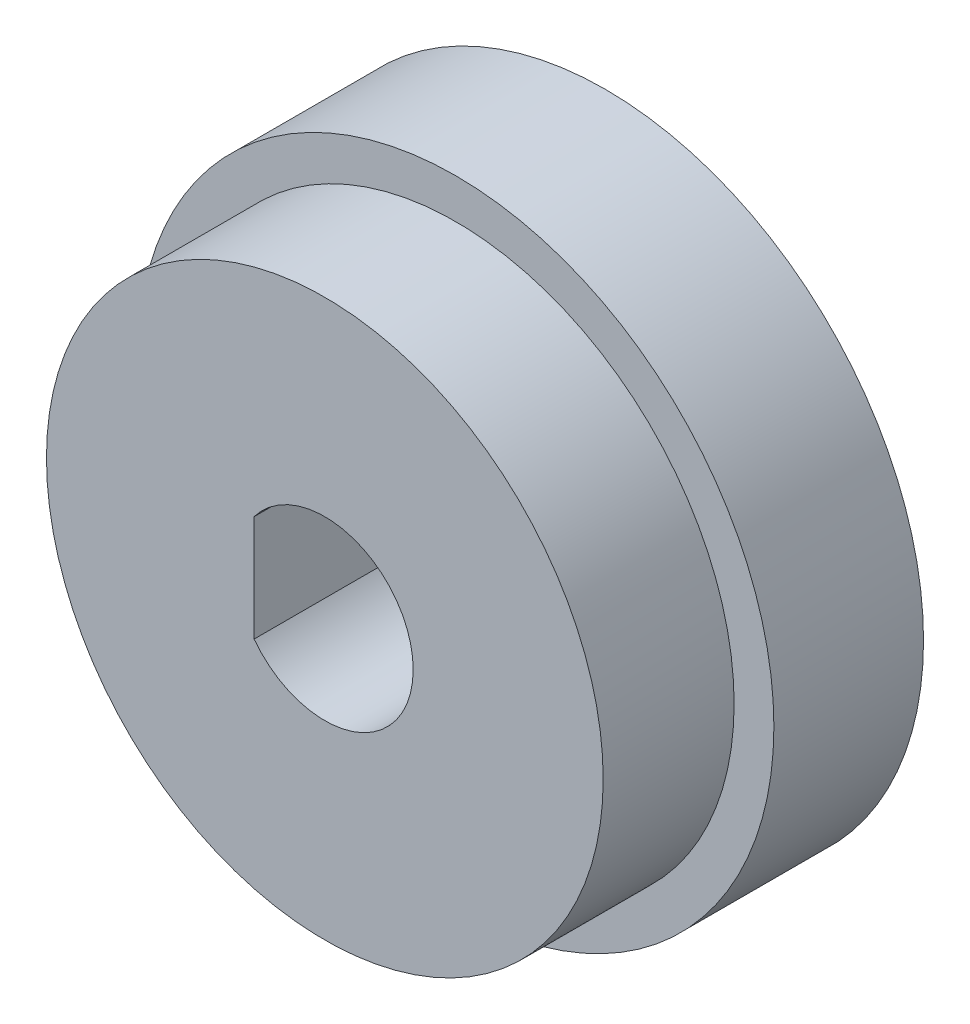
from build123d import *

# Parameters (mm, degrees)
SKETCH1_R           = 10.8
BOSS_EXTRUDE1_DEPTH = 5.08
SKETCH2_R           = 9.45
BOSS_EXTRUDE2_DEPTH = 4.445
CUT_EXTRUDE1_DEPTH  = 19.000156249


with BuildPart() as part:
    # Sketch1 → Boss-Extrude1 (new body)
    with BuildSketch(Plane.XY):
        Circle(SKETCH1_R)
    extrude(amount=BOSS_EXTRUDE1_DEPTH)

    # Sketch2 → Boss-Extrude2 (add)
    with BuildSketch(Plane.XY.offset(5.08)):
        Circle(SKETCH2_R)
    extrude(amount=BOSS_EXTRUDE2_DEPTH)

    # Sketch3 → Cut-Extrude1 (cut, through all)
    with BuildSketch(Plane.XY.offset(9.525)):
        with BuildLine():
            Line((-2.4, 0), (-2.4, -1.8))
            ThreePointArc((-2.4, -1.8), (3, 0), (-2.4, 1.8))
            Line((-2.4, 1.8), (-2.4, 0))
        make_face()
    extrude(amount=-CUT_EXTRUDE1_DEPTH, mode=Mode.SUBTRACT)


solid = part.part
